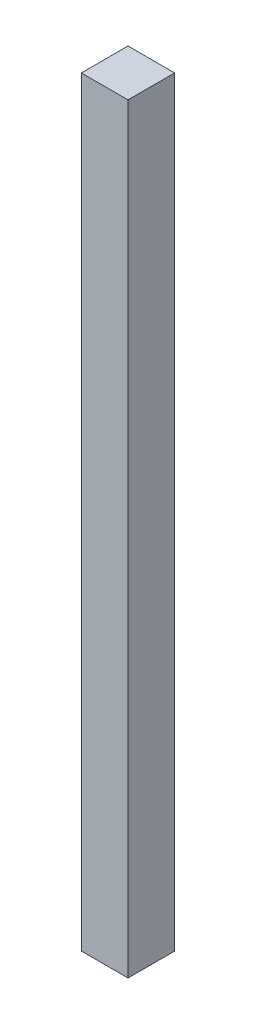
from build123d import *

# Parameters (mm, degrees)
ESQUISSE1_W        = 10
ESQUISSE1_H        = 163
BOSS_EXTRU_1_DEPTH = 10


with BuildPart() as part:
    # Esquisse1 → Boss.-Extru.1 (new body)
    with BuildSketch(Plane.XY):
        with Locations((-76.322185673, -3.861111111)):
            Rectangle(ESQUISSE1_W, ESQUISSE1_H)
    extrude(amount=BOSS_EXTRU_1_DEPTH)


solid = part.part
